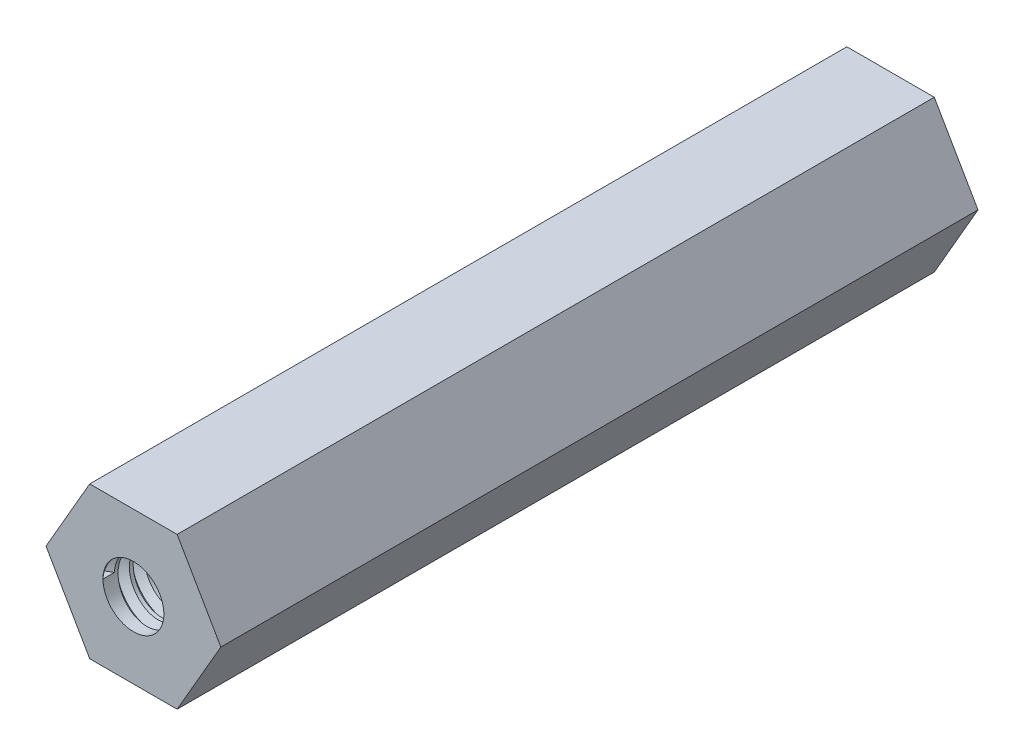
from build123d import *
from build123d.topology import SkipClean

# Parameters (mm, degrees)
EXTRUSI_N_HEX_PROFILE_DEPTH = 31.75
TAP_START                   = 31.75
CROQUIS3_R                  = 2.5527
TAP_HOLE_1_DEPTH            = 19.05
TAP_START_2                 = -12.7
CROQUIS3_3_R                = 2.5527
TAP_HOLE_2_DEPTH            = 19.05
ROSCA1_PITCH                = 1.27
ROSCA2_PITCH                = 1.27


with BuildPart() as part:
    # Croquis2 → Extrusión Hex Profile (new, symmetric)
    with BuildSketch(Plane.XY):
        Polygon((3.666174209, -6.35), (7.332348419, 0), (3.666174209, 6.35), (-3.666174209, 6.35), (-7.332348419, 0), (-3.666174209, -6.35), align=None)
    extrude(amount=EXTRUSI_N_HEX_PROFILE_DEPTH, both=True)

    # Croquis3 → Tap Hole 1 (cut)
    with BuildSketch(Plane.XY.offset(TAP_START)):
        Circle(CROQUIS3_R)
    extrude(amount=-TAP_HOLE_1_DEPTH, mode=Mode.SUBTRACT)

    # Croquis3<3> → Tap Hole 2 (cut)
    with BuildSketch(Plane.XY.offset(TAP_START_2)):
        Circle(CROQUIS3_3_R)
    extrude(amount=-TAP_HOLE_2_DEPTH, mode=Mode.SUBTRACT)

    # Rosca1: the profile of Perfil de rosca1 profile screwed along a right-hand helix of 15 turns, 8 arcs to a turn; built about Z, then put on its axis
    rosca1_z = Axis((0, 0, 0), (0, 0, 1))
    rosca1_corners = [(2.5524, 0, -0.000173205), (3.240107661, 0, 0.396874998), (3.240107661, 0, 0.555624998), (2.5524, 0, 0.952673202)]
    with BuildLine(mode=Mode.PRIVATE) as rosca1_profile:
        Line(rosca1_corners[0], rosca1_corners[1])
        Line(rosca1_corners[1], rosca1_corners[2])
        Line(rosca1_corners[2], rosca1_corners[3])
        Line(rosca1_corners[3], rosca1_corners[0])
    rosca1_cap = Face(rosca1_profile.wire())
    rosca1_turn_angles = [0, 22.5, 45, 67.5, 90, 112.5, 135, 157.5, 180, 202.5, 225, 247.5, 270, 292.5, 315, 337.5, 360]
    rosca1_turn_weights = [1, 0.9238795325112867, 1, 0.9238795325112867, 1, 0.9238795325112867, 1, 0.9238795325112867, 1, 0.9238795325112867, 1, 0.9238795325112867, 1, 0.9238795325112867, 1, 0.9238795325112867, 1]
    rosca1_turn_rails = [Edge.make_bspline([Vector(p[0], p[1], 0).rotate(rosca1_z, rosca1_turn_angles[k]) / rosca1_turn_weights[k] + Vector(0, 0, p[2] + ROSCA1_PITCH * rosca1_turn_angles[k] / 360) for k in range(17)], [0, 0, 0, 1, 1, 2, 2, 3, 3, 4, 4, 5, 5, 6, 6, 7, 7, 8, 8, 8], 2, rosca1_turn_weights) for p in rosca1_corners]
    rosca1_turn_sides = [Face.make_surface_from_curves(rosca1_turn_rails[p[0]], rosca1_turn_rails[p[1]]) for p in [(0, 1), (1, 2), (2, 3), (3, 0)]]
    rosca1 = Plane(origin=(0, 0, -31.75), x_dir=(1, 0, 0), z_dir=(0, 0, 1)) * Solid(Shell([*[p.moved(Location((0, 0, ROSCA1_PITCH * i))) for i in range(15) for p in rosca1_turn_sides], rosca1_cap, rosca1_cap.rotate(rosca1_z, 5400).moved(Location((0, 0, ROSCA1_PITCH * 5400 / 360)))]))
    add(rosca1, mode=Mode.SUBTRACT)

    # Rosca2: the profile of Perfil de rosca2 profile screwed along a right-hand helix of 15 turns, 8 arcs to a turn; built about Z, then put on its axis
    with SkipClean():  # the faces are left unmerged after this step: merging them gives an invalid solid
        rosca2_z = Axis((0, 0, 0), (0, 0, 1))
        rosca2_corners = [(2.5524, 0, -0.000173205), (3.240107661, 0, 0.396874998), (3.240107661, 0, 0.555624998), (2.5524, 0, 0.952673202)]
        with BuildLine(mode=Mode.PRIVATE) as rosca2_profile:
            Line(rosca2_corners[0], rosca2_corners[1])
            Line(rosca2_corners[1], rosca2_corners[2])
            Line(rosca2_corners[2], rosca2_corners[3])
            Line(rosca2_corners[3], rosca2_corners[0])
        rosca2_cap = Face(rosca2_profile.wire())
        rosca2_turn_angles = [0, 22.5, 45, 67.5, 90, 112.5, 135, 157.5, 180, 202.5, 225, 247.5, 270, 292.5, 315, 337.5, 360]
        rosca2_turn_weights = [1, 0.9238795325112867, 1, 0.9238795325112867, 1, 0.9238795325112867, 1, 0.9238795325112867, 1, 0.9238795325112867, 1, 0.9238795325112867, 1, 0.9238795325112867, 1, 0.9238795325112867, 1]
        rosca2_turn_rails = [Edge.make_bspline([Vector(p[0], p[1], 0).rotate(rosca2_z, rosca2_turn_angles[k]) / rosca2_turn_weights[k] + Vector(0, 0, p[2] + ROSCA2_PITCH * rosca2_turn_angles[k] / 360) for k in range(17)], [0, 0, 0, 1, 1, 2, 2, 3, 3, 4, 4, 5, 5, 6, 6, 7, 7, 8, 8, 8], 2, rosca2_turn_weights) for p in rosca2_corners]
        rosca2_turn_sides = [Face.make_surface_from_curves(rosca2_turn_rails[p[0]], rosca2_turn_rails[p[1]]) for p in [(0, 1), (1, 2), (2, 3), (3, 0)]]
        rosca2 = Plane(origin=(0, 0, 31.75), x_dir=(-1, 0, 0), z_dir=(0, 0, -1)) * Solid(Shell([*[p.moved(Location((0, 0, ROSCA2_PITCH * i))) for i in range(15) for p in rosca2_turn_sides], rosca2_cap, rosca2_cap.rotate(rosca2_z, 5400).moved(Location((0, 0, ROSCA2_PITCH * 5400 / 360)))]))
        add(rosca2, mode=Mode.SUBTRACT)


solid = part.part
